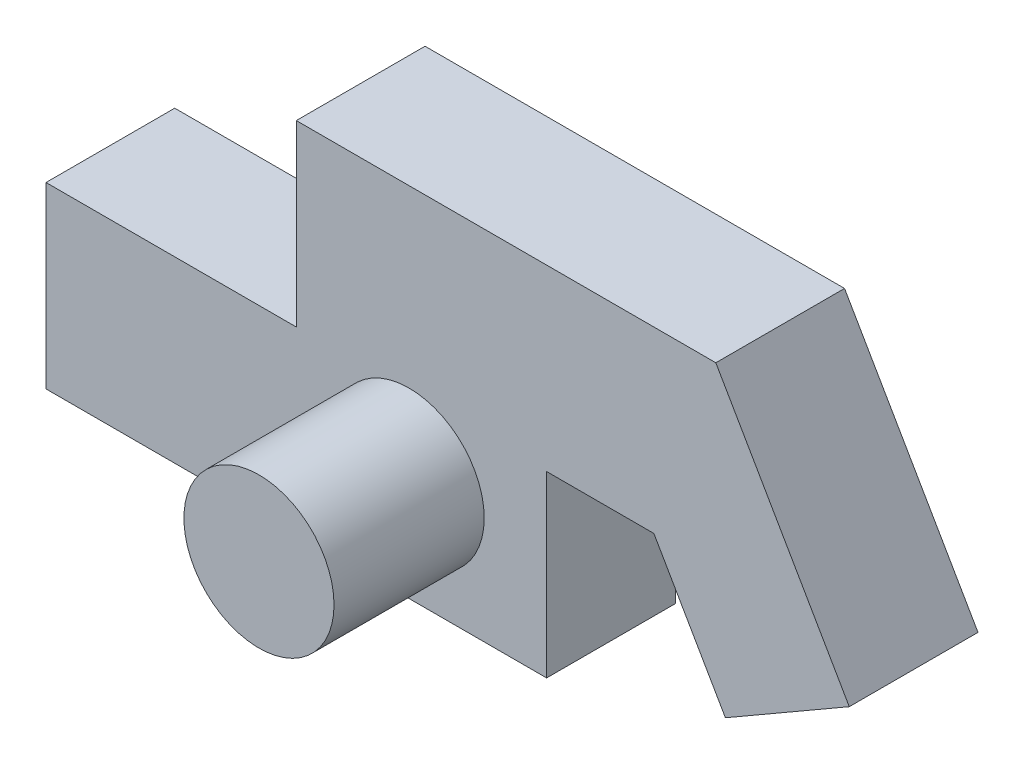
from build123d import *

# Parameters (mm, degrees)
RESSALTO_EXTRUS_O1_DEPTH = 18
ESBO_O2_R                = 10.495574175
RESSALTO_EXTRUS_O2_DEPTH = 21


with BuildPart() as part:
    # Esboço1 → Ressalto-extrusão1 (new body)
    with BuildSketch(Plane.XY):
        Polygon((70, 0), (70, 25), (85, 25), (95, 7.679491924), (112.320508076, 17.679491924), (93.660254038, 50), (35, 50), (35, 25), (0, 25), (0, 0), align=None)
    extrude(amount=RESSALTO_EXTRUS_O1_DEPTH)

    # Esboço2 → Ressalto-extrusão2 (add)
    with BuildSketch(Plane.XY.offset(18)):
        with Locations((50.779477818, 14.995224281)):
            Circle(ESBO_O2_R)
    extrude(amount=RESSALTO_EXTRUS_O2_DEPTH)


solid = part.part
